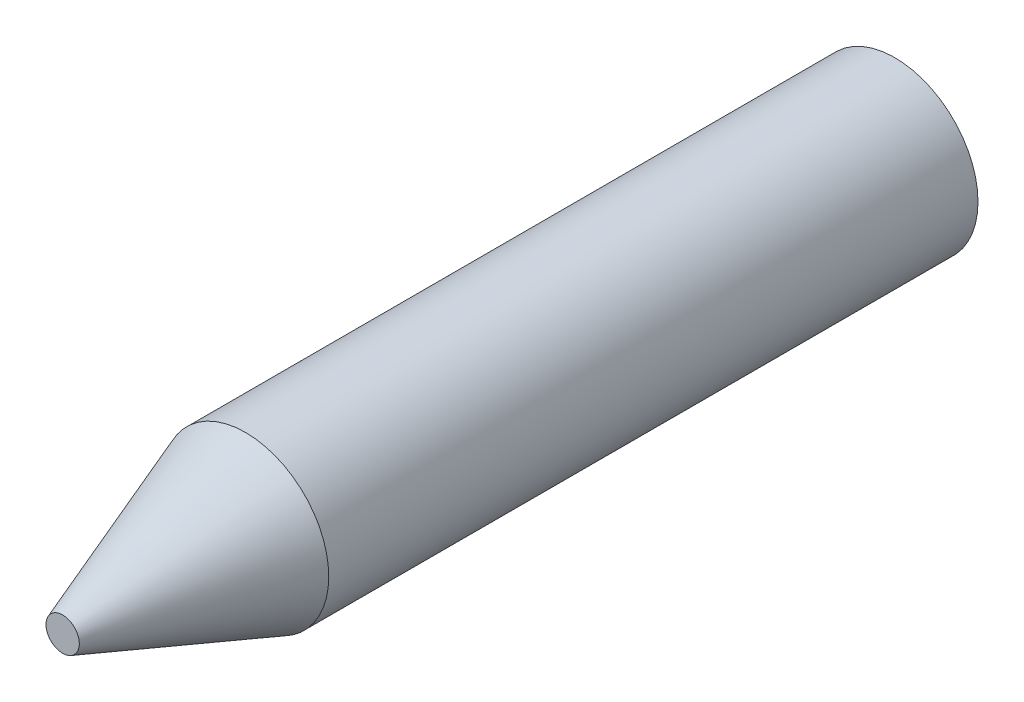
from build123d import *


with BuildPart() as part:
    # Sketch1 → Revolve1 (revolve)
    with BuildSketch(Plane(origin=(0, 0, 0), x_dir=(1, 0, 0), z_dir=(0, 1, 0))):
        Polygon((0, 100), (10, 100), (10, 21.979819356), (2, 0), (0, 0), align=None)
    revolve(axis=Axis((0, 0, 68.693168404), (0, 0, -1)))


solid = part.part
